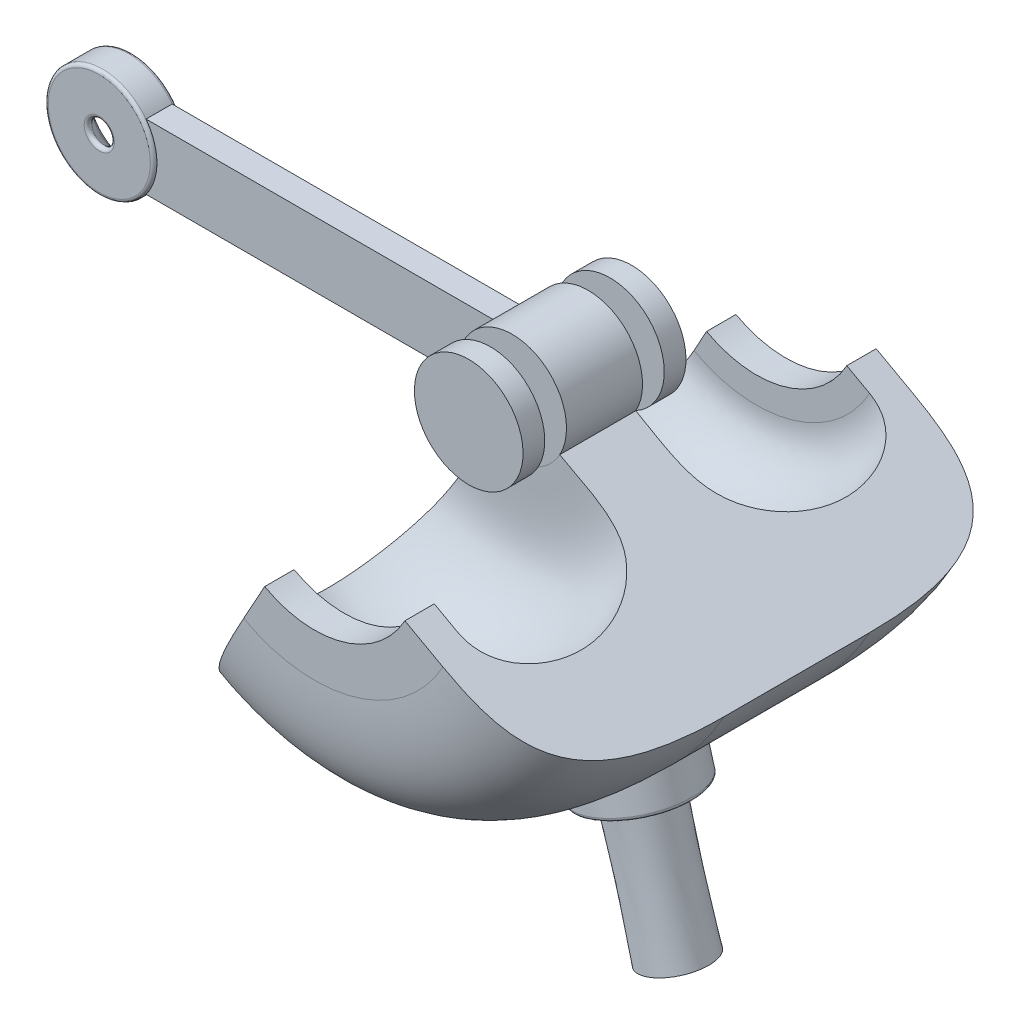
from build123d import *

# Parameters (mm, degrees)
FILLET3_R           = 1.5
SKETCH10_R          = 25
BOSS_EXTRUDE2_DEPTH = 17.5
REVOLVE3_ANGLE      = 90
SKETCH19_R          = 25
BOSS_EXTRUDE3_DEPTH = 50
FILLET6_R           = 1.5


with BuildPart() as part:
    # Revolve2: read off the stored shape, not the designer's step
    # Revolve2 outline → Revolve2 (revolve)
    with BuildSketch(Plane(origin=(-100, 0, 0), x_dir=(1, 0, 0), z_dir=(0, -1, 0))):
        with BuildLine():
            Line((25, 15.077822465), (5, 15.077822465))
            add(Edge.make_bspline(
                [(5, 15.077822465), (5, 13.603191541), (7.163877182, 10.510300403), (9.563044246, 8.1760062), (11.404840794, 6.733196596)],
                knots=[0, 0, 0, 0, 0.383821227, 1, 1, 1, 1], degree=3))
            Line((11.404840794, 6.733196596), (20, 0))
            Line((20, 0), (25, 0))
            Line((25, 0), (25, 15.077822465))
        make_face()
    revolve(axis=Axis((-100, 0, 0), (0, 0, 1)))

    # Sketch6 → Loft2 section 0
    with BuildSketch(Plane(origin=(-80, 0, 0), x_dir=(0, 0, -1), z_dir=(1, 0, 0))):
        with BuildLine():
            Line((-13.538911233, 15), (-1.538911233, 15))
            Line((-1.538911233, 15), (-1.538911233, -15))
            Line((-1.538911233, -15), (-13.538911233, -15))
            Line((-13.538911233, -15), (-13.538911233, 15))
        make_face()
    # Sketch5 → Loft2 section 1
    with BuildSketch(Plane(origin=(80, 0, 0), x_dir=(0, 0, -1), z_dir=(1, 0, 0))):
        with BuildLine():
            Line((-1.538911233, 15), (-13.538911233, 15))
            Line((-13.538911233, 15), (-13.538911233, -15))
            Line((-13.538911233, -15), (-1.538911233, -15))
            Line((-1.538911233, -15), (-1.538911233, 15))
        make_face()
    loft()

    # Fillet3
    fillet3_edges = [part.edges().sort_by_distance(p)[0] for p in [
        (-125, 0, 0),
        (-120, 0, 0),
        (-105, 0, 15.077822465),
        (-125, 0, 15.077822465),
    ]]
    fillet(fillet3_edges, radius=FILLET3_R)

    # Sketch10 → Boss-Extrude2 (add, symmetric)
    with BuildSketch(Plane.XY.offset(7.538911233)):
        with Locations((100, 0)):
            Circle(SKETCH10_R)
    extrude(amount=BOSS_EXTRUDE2_DEPTH, both=True)

    # Sketch13 → Revolve3 (revolve, symmetric)
    with BuildSketch(Plane(origin=(92.307490084, 26.647256571, 0), x_dir=(0, 0, -1), z_dir=(0.9607678704250572, 0.27735374372613175, 0))) as revolve3_sk:
        with BuildLine():
            Line((-41.003397863, -157.420055221), (25.925575398, -157.420055221))
            add(Edge.make_bspline(
                [(100.918479625, -95.235374373), (100.918479625, -103.819187393), (98.943583911, -138.760414592), (77.566461401, -157.420055221), (25.925575398, -157.420055221)],
                knots=[0, 0, 0, 0, 0.2175197, 1, 1, 1, 1], degree=3))
            Line((100.918479625, -95.235374373), (100.918479625, -75.235374373))
            Line((100.918479625, -75.235374373), (87.386654253, -75.235374373))
            Line((87.386654253, -75.235374373), (87.386654253, -87.235374373))
            add(Edge.make_bspline(
                [(9.961088767, -52.735374373), (9.961088767, -66.891290807), (6.962182075, -96.91274992), (53.556498987, -123.277440042), (87.386654253, -103.247936142), (87.386654253, -87.235374373)],
                knots=[0, 0, 0, 0, 0.3054705, 0.682656613, 1, 1, 1, 1], degree=3))
            Line((9.961088767, -52.735374373), (-25.038911233, -52.735374373))
            add(Edge.make_bspline(
                [(-25.038911233, -52.735374373), (-25.038911233, -66.891290807), (-22.04000454, -96.91274992), (-68.634321452, -123.277440042), (-102.464476718, -103.247936142), (-102.464476718, -87.235374373)],
                knots=[0, 0, 0, 0, 0.3054705, 0.682656613, 1, 1, 1, 1], degree=3))
            Line((-102.464476718, -87.235374373), (-102.464476718, -75.235374373))
            Line((-102.464476718, -75.235374373), (-115.99630209, -75.235374373))
            Line((-115.99630209, -75.235374373), (-115.99630209, -95.235374373))
            add(Edge.make_bspline(
                [(-115.99630209, -95.235374373), (-115.99630209, -103.819187393), (-114.021406376, -138.760414592), (-92.644283866, -157.420055221), (-41.003397863, -157.420055221)],
                knots=[0, 0, 0, 0, 0.2175197, 1, 1, 1, 1], degree=3))
        make_face()
    revolve(axis=Axis((100, 0, 25.038911233), (0, 0, -1)), revolution_arc=REVOLVE3_ANGLE / 2)
    revolve(revolve3_sk.sketch, axis=Axis((100, 0, 25.038911233), (0, 0, 1)), revolution_arc=REVOLVE3_ANGLE / 2)

    # Sketch19 → Boss-Extrude3 (add)
    with BuildSketch(Plane(origin=(35.427884289, -122.724043613, 0), x_dir=(-0.9607678704226367, -0.27735374373451605, 0), z_dir=(0.27735374373451605, -0.9607678704226368, 0))):
        with Locations((-96.076787042, -7.538911233)):
            Circle(SKETCH19_R)
    extrude(amount=BOSS_EXTRUDE3_DEPTH)

    # Loft4: read off the stored shape, not the designer's step
    # Loft4: loft between two sections, ruled curve by curve
    loft4_from = [
        Edge.make_bspline([(127.882970281, -148.075886157, 12.129325865), (119.062324499, -150.622223525, -16.431352943), (146.502507055, -142.700812334, -25.612182209), (155.323152838, -140.154474966, 2.9484966), (164.14379862, -137.608137599, 31.509175408), (136.703616063, -145.52954879, 40.690004674), (127.882970281, -148.075886157, 12.129325865)], [0, 0, 0, 0, 0.5, 0.5, 0.5, 1, 1, 1, 1], 3, [1, 0.333333333, 0.333333333, 1, 0.333333333, 0.333333333, 1]),
    ]
    loft4_to = [
        Edge.make_bspline([(148.940358563, -205.753913799, 18.677671161), (127.536833252, -211.932667332, -1.41491725), (146.841146631, -206.359912715, -23.692437107), (168.244671942, -200.181159182, -3.599848696), (189.648197253, -194.002405649, 16.492739715), (170.343883874, -199.575160266, 38.770259572), (148.940358563, -205.753913799, 18.677671161)], [0, 0, 0, 0, 0.5, 0.5, 0.5, 1, 1, 1, 1], 3, [1, 0.333333333, 0.333333333, 1, 0.333333333, 0.333333333, 1]),
    ]
    loft4 = Solid(Shell([*[Face.make_surface_from_curves(loft4_from[k], loft4_to[k]) for k in range(1)], Face(Wire(loft4_from)), Face(Wire(loft4_to))]))
    add(loft4)

    # Fillet6
    fillet6_edges = [part.edges().sort_by_distance(p)[0] for p in [
        (165.62225832, -137.181336969, 7.538911233),
        (155.323152838, -140.154474966, 2.9484966),
    ]]
    fillet(fillet6_edges, radius=FILLET6_R)

    # Sketch24 → Revolve4 (revolve)
    with BuildSketch(Plane(origin=(92.307490084, 26.647256571, 0), x_dir=(0, 0, -1), z_dir=(0.9607678704250572, 0.27735374372613175, 0)), mode=Mode.PRIVATE) as revolve4_sk:
        Polygon((-25.038911233, -17.275893978), (-35.038911233, -17.275893978), (-35.038911233, -2.735374373), (-45.038911233, -2.735374373), (-45.038911233, -27.735374373), (29.961088767, -27.735374373), (29.961088767, -2.735374373), (19.961088767, -2.735374373), (19.961088767, -17.275893978), (9.961088767, -17.275893978), align=None)
    revolve(revolve4_sk.sketch.rotate(Axis((100, 0, 45.038911233), (0, 0, -1)), 196.102331159), axis=Axis((100, 0, 45.038911233), (0, 0, -1)))


solid = part.part
